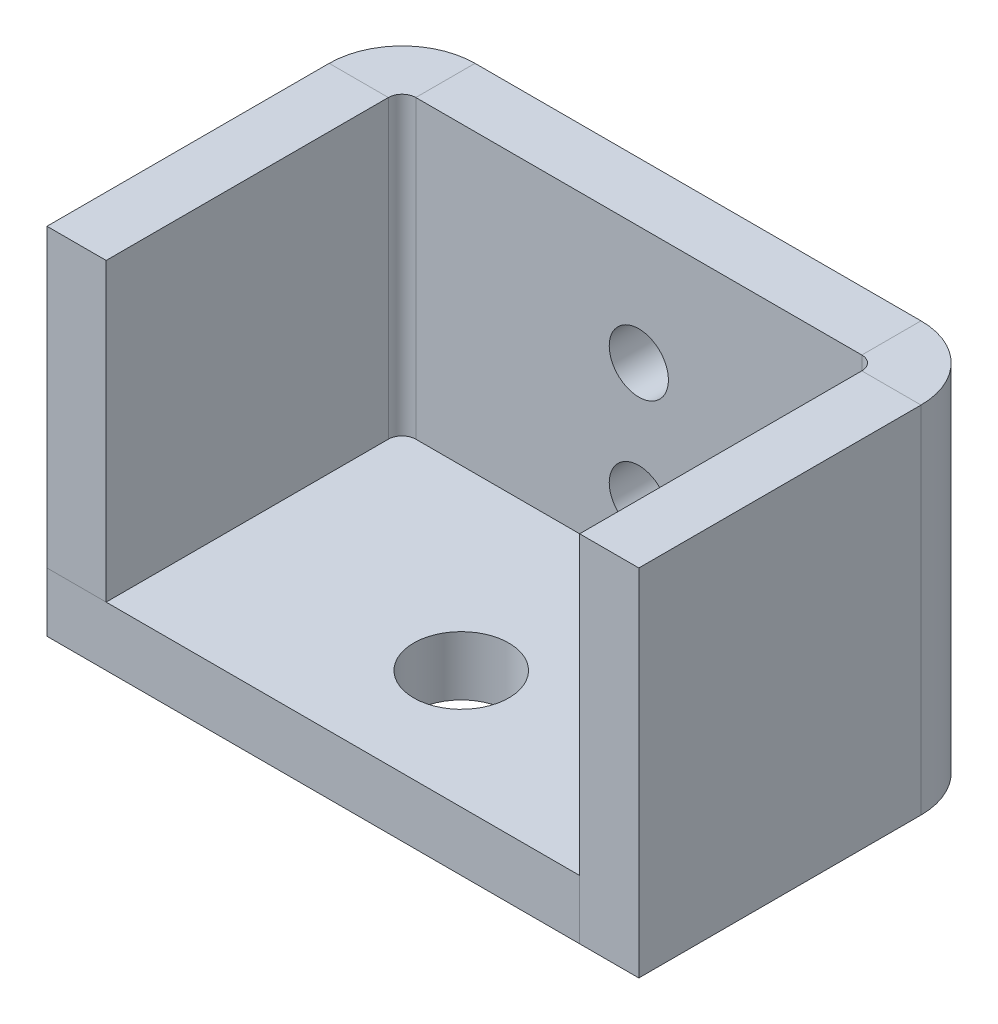
from build123d import *

# Parameters (mm, degrees)
SKETCH1_W                    = 25.4
SKETCH1_H                    = 19.05
BASE_FLANGE1_DEPTH           = 3.175
EDGE_FLANGE1_STRIP_W         = 14.1732
EDGE_FLANGE1_STRIP_H         = 3.175
EDGE_FLANGE1_STRIP_CUT_DEPTH = 19.05
EDGE_FLANGE1_DEPTH           = 19.05
EDGE_FLANGE2_STRIP_W         = 14.1732
EDGE_FLANGE2_STRIP_H         = 3.175
EDGE_FLANGE2_STRIP_CUT_DEPTH = 19.05
EDGE_FLANGE2_DEPTH           = 19.05
BASE_FLANGE2_DEPTH           = 3.175
SKETCH35_R                   = 1.5875
CUT_EXTRUDE2_DEPTH           = 27.563955842
SKETCH45_W                   = 2.5527
SKETCH45_H                   = 3.175


# Sheet-metal steps are written as plain solids
with BuildPart() as part:
    # Sketch1 → Base-Flange1 (new body)
    with BuildSketch(Plane.XY):
        Rectangle(SKETCH1_W, SKETCH1_H)
    extrude(amount=-BASE_FLANGE1_DEPTH)

    # Edge-Flange1 strip (across the edge) → Edge-Flange1 strip cut (cut)
    with BuildSketch(Plane(origin=(12.7, -9.525, 0), x_dir=(-1, 0, 0), z_dir=(0, 1, 0))):
        with Locations((-6.35, -1.5875)):
            Rectangle(EDGE_FLANGE1_STRIP_W, EDGE_FLANGE1_STRIP_H)
    extrude(amount=EDGE_FLANGE1_STRIP_CUT_DEPTH, mode=Mode.SUBTRACT)

    # Edge-Flange1 section (across the edge) → Edge-Flange1 (add)
    with BuildSketch(Plane(origin=(12.7, -9.525, 0), x_dir=(-1, 0, 0), z_dir=(0, 1, 0))):
        with BuildLine():
            Line((-3.175, 0.7366), (-3.175, 15.875))
            Line((-3.175, 15.875), (0, 15.875))
            Line((0, 15.875), (0, 0.7366))
            ThreePointArc((0, 0.7366), (0.215745145, 0.215745145), (0.7366, 0))
            Line((0.7366, 0), (0.7366, -3.175))
            ThreePointArc((0.7366, -3.175), (-2.029318885, -2.029318885), (-3.175, 0.7366))
        make_face()
    extrude(amount=EDGE_FLANGE1_DEPTH)

    # Edge-Flange2 strip (across the edge) → Edge-Flange2 strip cut (cut)
    with BuildSketch(Plane(origin=(-12.7, 9.525, 0), x_dir=(1, 0, 0), z_dir=(0, -1, 0))):
        with Locations((-6.35, -1.5875)):
            Rectangle(EDGE_FLANGE2_STRIP_W, EDGE_FLANGE2_STRIP_H)
    extrude(amount=EDGE_FLANGE2_STRIP_CUT_DEPTH, mode=Mode.SUBTRACT)

    # Edge-Flange2 section (across the edge) → Edge-Flange2 (add)
    with BuildSketch(Plane(origin=(-12.7, 9.525, 0), x_dir=(1, 0, 0), z_dir=(0, -1, 0))):
        with BuildLine():
            Line((-3.175, 0.7366), (-3.175, 15.875))
            Line((-3.175, 15.875), (0, 15.875))
            Line((0, 15.875), (0, 0.7366))
            ThreePointArc((0, 0.7366), (0.215745145, 0.215745145), (0.7366, 0))
            Line((0.7366, 0), (0.7366, -3.175))
            ThreePointArc((0.7366, -3.175), (-2.029318885, -2.029318885), (-3.175, 0.7366))
        make_face()
    extrude(amount=EDGE_FLANGE2_DEPTH)

    # Sketch35 → Cut-Extrude2 (cut, through all)
    with BuildSketch(Plane(origin=(0, 0, -3.175), x_dir=(-1, 0, 0), z_dir=(0, 0, -1))):
        with Locations((0, 3.175)):
            Circle(SKETCH35_R)
        with Locations((0, -3.175)):
            Circle(SKETCH35_R)
        with Locations((0, -9.525)):
            Circle(SKETCH35_R)
        with Locations((0, -15.875)):
            Circle(SKETCH35_R)
        with Locations((0, -22.225)):
            Circle(SKETCH35_R)
    extrude(amount=-CUT_EXTRUDE2_DEPTH, mode=Mode.SUBTRACT)


with BuildPart() as body_2:
    # Sketch32 → Base-Flange2 (new body)
    with BuildSketch(Plane.XZ.offset(9.525)):
        with BuildLine():
            Line((-15.875, 15.875), (-15.875, 0.7366))
            ThreePointArc((-15.875, 0.7366), (-14.729318885, -2.029318885), (-11.9634, -3.175))
            Line((-11.9634, -3.175), (11.9634, -3.175))
            ThreePointArc((11.9634, -3.175), (14.729318885, -2.029318885), (15.875, 0.7366))
            Line((15.875, 0.7366), (15.875, 15.875))
            Line((15.875, 15.875), (-15.875, 15.875))
        make_face()
    extrude(amount=-BASE_FLANGE2_DEPTH)

    # Sketch45 → Tap Drill for 1/4-20 Tap1 (revolve, cut)
    with BuildSketch(Plane(origin=(0, -6.35, 9.525), x_dir=(0, 0, 1), z_dir=(1, 0, 0))):
        with Locations((1.27635, 1.5875)):
            Rectangle(SKETCH45_W, SKETCH45_H)
    revolve(axis=Axis((0, 0, 9.525), (0, -1, 0)), mode=Mode.SUBTRACT)


solid = Compound([part.part, body_2.part])
